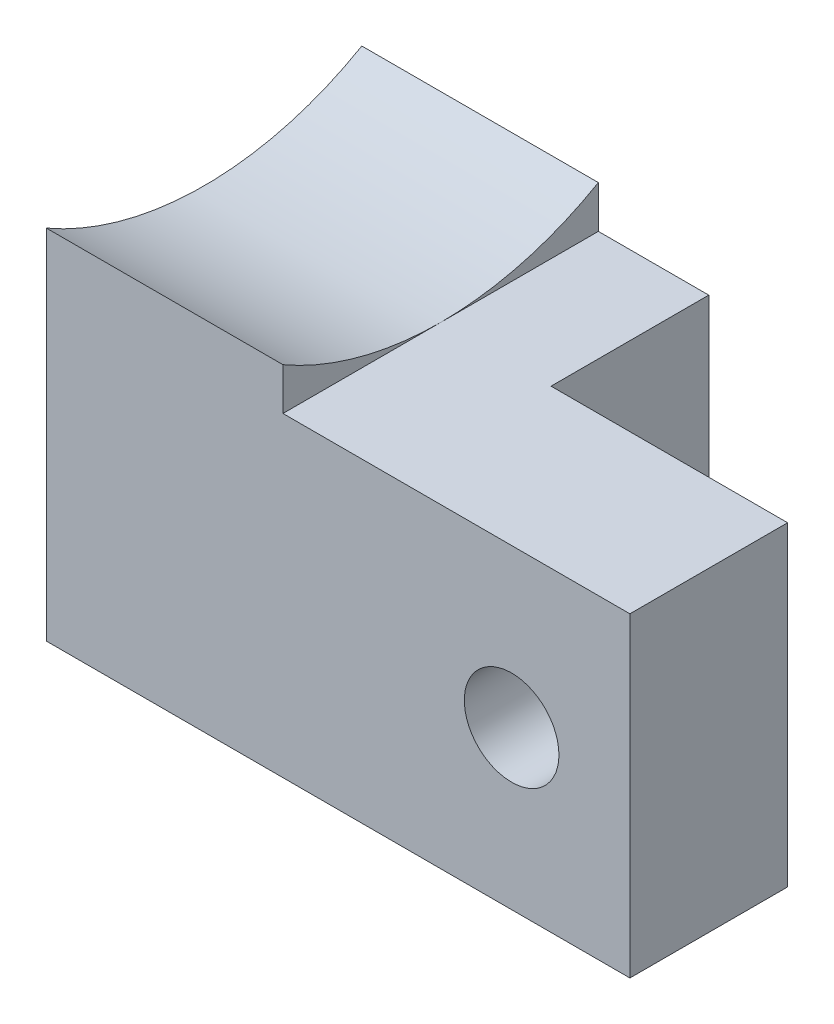
from build123d import *

# Parameters (mm, degrees)
CROQUIS2_W                  = 37
CROQUIS2_H                  = 20
SALIENTE_EXTRUIR2_DEPTH     = 20
CORTAR_EXTRUIR2_DEPTH       = 47.572524089
CORTAR_EXTRUIR2_DEPTH_BACK  = 47.572524089
CROQUIS3_W                  = 15
CROQUIS3_H                  = 10
CROQUIS4_R                  = 3
CORTAR_EXTRUIR3_DEPTH       = 44.231932642
CROQUIS8_W                  = 15
CROQUIS8_H                  = 20
SALIENTE_EXTRUIR4_DEPTH     = 2.679491924
CORTAR_EXTRUIR10_DEPTH      = 36.832945734
CORTAR_EXTRUIR10_DEPTH_BACK = 36.832945734
MOVER_START                 = -20
MOVER_CARA2_DEPTH           = 10
MOVER_START_2               = -10
MOVER_CARA2_2_OUTLINE_W     = 22
MOVER_CARA2_2_OUTLINE_H     = 2.679491924
MOVER_CARA2_2_OUTLINE_R     = 3
MOVER_CARA2_2_DEPTH         = 10
MOVER_CARA2_3_OUTLINE_R     = 3
MOVER_CARA2_3_DEPTH         = 10
MOVER_CARA2_4_OUTLINE_W     = 22
MOVER_CARA2_4_OUTLINE_H     = 2.679491924
MOVER_CARA2_4_OUTLINE_R     = 3
MOVER_CARA2_4_DEPTH         = 10
MOVER_CARA2_5_DEPTH         = 15
MOVER_CARA2_6_DEPTH         = 15


with BuildPart() as part:
    # Croquis2 → Saliente-Extruir2 (new body)
    with BuildSketch(Plane(origin=(0, 0, 0), x_dir=(1, 0, 0), z_dir=(0, 1, 0))):
        with Locations((18.5, 10)):
            Rectangle(CROQUIS2_W, CROQUIS2_H)
    extrude(amount=SALIENTE_EXTRUIR2_DEPTH)

    # Croquis3 → Cortar-Extruir2 (cut, two sides: drawn at the far end of the back side and taken through both)
    with BuildSketch(Plane(origin=(0, 0, 0), x_dir=(1, 0, 0), z_dir=(0, 1, 0)).offset(-CORTAR_EXTRUIR2_DEPTH_BACK)):
        with Locations((7.5, 15)):
            Rectangle(CROQUIS3_W, CROQUIS3_H)
    extrude(amount=CORTAR_EXTRUIR2_DEPTH + CORTAR_EXTRUIR2_DEPTH_BACK, mode=Mode.SUBTRACT)

    # Croquis4 → Cortar-Extruir3 (cut, through all)
    with BuildSketch(Plane(origin=(0, 0, -10), x_dir=(-1, 0, 0), z_dir=(0, 0, -1))):
        with Locations((-7.5, 10)):
            Circle(CROQUIS4_R)
    extrude(amount=-CORTAR_EXTRUIR3_DEPTH, mode=Mode.SUBTRACT)

    # Croquis8 → Saliente-Extruir4 (add)
    with BuildSketch(Plane.XZ):
        with Locations((29.5, -10)):
            Rectangle(CROQUIS8_W, CROQUIS8_H)
    extrude(amount=SALIENTE_EXTRUIR4_DEPTH)

    # Croquis9 → Cortar-Extruir10 (cut, two sides: drawn at the far end of the back side and taken through both)
    with BuildSketch(Plane.ZY.offset(-22).offset(-CORTAR_EXTRUIR10_DEPTH_BACK)):
        with BuildLine():
            Line((-81.034656774, -37.917867438), (-20, -2.679491924))
            ThreePointArc((-20, -2.679491924), (-10, 0), (0, -2.679491924))
            Line((0, -2.679491924), (61.034656774, -37.917867438))
            Line((61.034656774, -37.917867438), (61.034656774, -178.871369507))
            Line((61.034656774, -178.871369507), (-81.034656774, -178.871369507))
            Line((-81.034656774, -178.871369507), (-81.034656774, -37.917867438))
        make_face()
    extrude(amount=CORTAR_EXTRUIR10_DEPTH + CORTAR_EXTRUIR10_DEPTH_BACK, mode=Mode.SUBTRACT)

    # Mover cara2: read off the stored shape, not the designer's step
    # Mover cara2 outline → Mover cara2 (cut)
    with BuildSketch(Plane.XY.offset(MOVER_START)):
        Polygon((15, 20), (15, 17.320508076), (22, 17.320508076), (22, -2.679491924), (37, -2.679491924), (37, 20), align=None)
    extrude(amount=MOVER_CARA2_DEPTH, mode=Mode.SUBTRACT)

    # Mover cara2 2 outline → Mover cara2 2 (cut)
    with BuildSketch(Plane.XY.offset(MOVER_START_2)):
        with Locations((26, 18.660254038)):
            Rectangle(MOVER_CARA2_2_OUTLINE_W, MOVER_CARA2_2_OUTLINE_H)
        with Locations((29.5, 7.320508076)):
            Circle(MOVER_CARA2_2_OUTLINE_R)
    extrude(amount=MOVER_CARA2_2_DEPTH, mode=Mode.SUBTRACT)

    # Mover cara2 3 outline → Mover cara2 3 (add)
    # profile 1 of 2: a face of its own
    with BuildSketch(Plane.XY.offset(MOVER_START_2)):
        Polygon((37, 17.320508076), (22, 17.320508076), (22, 0), (0, 0), (0, -2.679491924), (37, -2.679491924), align=None)
        with Locations((29.5, 7.320508076)):
            Circle(MOVER_CARA2_3_OUTLINE_R, mode=Mode.SUBTRACT)
    # profile 2 of 2: a face of its own
    with BuildSketch(Plane.XY.offset(MOVER_START_2)):
        with Locations((7.5, 10)):
            Circle(MOVER_CARA2_3_OUTLINE_R)
    extrude(amount=MOVER_CARA2_3_DEPTH)

    # Mover cara2 4 outline → Mover cara2 4 (add)
    with BuildSketch(Plane.XY.offset(MOVER_START)):
        with Locations((11, -1.339745962)):
            Rectangle(MOVER_CARA2_4_OUTLINE_W, MOVER_CARA2_4_OUTLINE_H)
        with Locations((7.5, 10)):
            Circle(MOVER_CARA2_4_OUTLINE_R)
    extrude(amount=MOVER_CARA2_4_DEPTH)

    # Mover cara2 5 outline → Mover cara2 5 (cut)
    with BuildSketch(Plane.YZ):
        with BuildLine():
            ThreePointArc((20, 0), (18.00199155, -4.823619098), (17.320508076, -10))
            Line((17.320508076, -10), (20, -10))
            Line((20, -10), (20, 0))
        make_face()
    extrude(amount=MOVER_CARA2_5_DEPTH, mode=Mode.SUBTRACT)

    # Mover cara2 6 outline → Mover cara2 6 (add)
    with BuildSketch(Plane.YZ):
        with BuildLine():
            Line((0, -20), (20, -20))
            ThreePointArc((20, -20), (18.00199155, -15.176380902), (17.320508076, -10))
            Line((17.320508076, -10), (0, -10))
            Line((0, -10), (0, -20))
        make_face()
    extrude(amount=MOVER_CARA2_6_DEPTH)


solid = part.part
